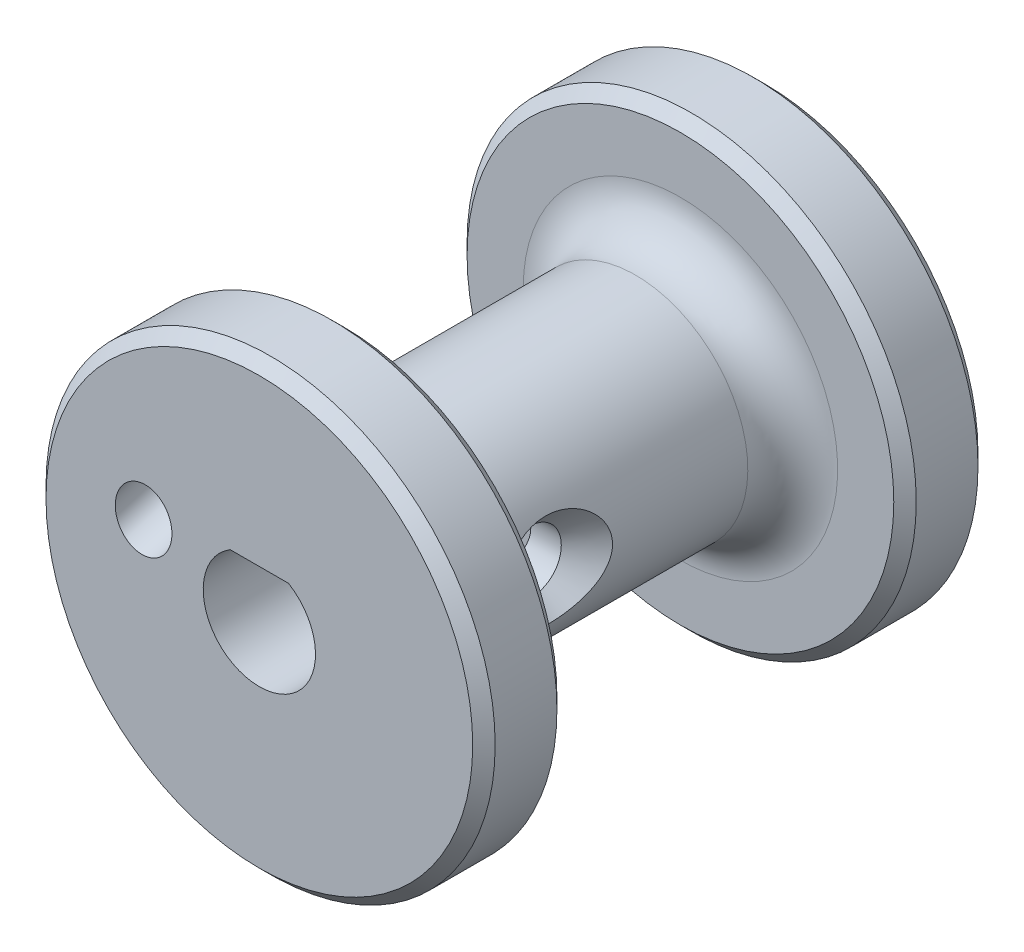
from build123d import *

# Parameters (mm, degrees)
BOSS_EXTRUDE1_DEPTH            = 9.525
BOSS_EXTRUDE1_DEPTH_BACK       = 9.525
SKETCH1_R                      = 6.35
SKETCH1_R_2                    = 3.175
SKETCH2_R                      = 12.7
SKETCH2_R_2                    = 6.35
SKETCH2_R_3                    = 3.175
BOSS_EXTRUDE3_DEPTH            = 4.7625
SKETCH3_R                      = 3.175
BOSS_EXTRUDE4_DEPTH            = 28.575
FILLET1_R                      = 2.54
CHAMFER1_SIZE                  = 0.635
CUT_EXTRUDE1_DEPTH             = 13.97
CUT_EXTRUDE2_REACH             = 39.354
SKETCH6_R                      = 1.5875
CUT_EXTRUDE2_DIRECTION_2_REACH = 39.354


# Read off the part's stored shape, not the designer's step: CSK for M3 Flat Head Machine Screw1
with BuildPart() as part:
    # Sketch1 → Boss-Extrude1 (new, two sides: drawn at the far end of the back side and taken through both)
    with BuildSketch(Plane.XY.offset(-BOSS_EXTRUDE1_DEPTH_BACK)):
        Circle(SKETCH1_R)
        Circle(SKETCH1_R_2, mode=Mode.SUBTRACT)
    extrude(amount=BOSS_EXTRUDE1_DEPTH + BOSS_EXTRUDE1_DEPTH_BACK)

    # Sketch2 → Boss-Extrude3 (add)
    # profile 1 of 2: a face of its own
    with BuildSketch(Plane(origin=(0, 0, -9.525), x_dir=(-1, 0, 0), z_dir=(0, 0, -1))):
        with Locations(Location((0, 0, 0), (0, 0, 180))):
            Circle(SKETCH2_R)
        with Locations(Location((0, 0, 0), (0, 0, 180))):
            Circle(SKETCH2_R_2, mode=Mode.SUBTRACT)
    # profile 2 of 2: a face of its own
    with BuildSketch(Plane(origin=(0, 0, -9.525), x_dir=(-1, 0, 0), z_dir=(0, 0, -1))):
        with Locations(Location((0, 0, 0), (0, 0, 180))):
            Circle(SKETCH2_R_2)
        with Locations(Location((0, 0, 0), (0, 0, 180))):
            Circle(SKETCH2_R_3, mode=Mode.SUBTRACT)
    boss_extrude3 = extrude(amount=BOSS_EXTRUDE3_DEPTH)

    # Mirror1: Boss-Extrude3 across plane
    add(boss_extrude3.mirror(Plane.XY))

    # Sketch3 → Boss-Extrude4 (add, through all)
    with BuildSketch(Plane(origin=(0, 0, -14.2875), x_dir=(-1, 0, 0), z_dir=(0, 0, -1))):
        Circle(SKETCH3_R)
    extrude(amount=-BOSS_EXTRUDE4_DEPTH)

    # Fillet1
    fillet1_edges = [part.edges().sort_by_distance(p)[0] for p in [
        (-6.35, 0, -9.525),
        (-6.35, 0, 9.525),
    ]]
    fillet(fillet1_edges, radius=FILLET1_R)

    # Chamfer1
    chamfer1_edges = [part.edges().sort_by_distance(p)[0] for p in [
        (-12.7, 0, -9.525),
        (-12.7, 0, -14.2875),
        (-12.7, 0, 14.2875),
        (-12.7, 0, 9.525),
    ]]
    chamfer(chamfer1_edges, length=CHAMFER1_SIZE)

    # Sketch4 → Cut-Extrude1 (cut)
    with BuildSketch(Plane.XY.offset(14.2875)):
        with BuildLine():
            Line((1.651, 2.711977876), (-1.651, 2.711977876))
            ThreePointArc((-1.651, 2.711977876), (-1.555425987, -2.767900829), (3.175, 0))
            ThreePointArc((3.175, 0), (2.767900829, 1.555425987), (1.651, 2.711977876))
        make_face()
    extrude(amount=-CUT_EXTRUDE1_DEPTH, mode=Mode.SUBTRACT)

    # Sketch6 → Cut-Extrude2 (cut, up to next)
    with BuildSketch(Plane(origin=(-6.544693312, 1.737013471, 14.2875), x_dir=(0.9927863104442903, -0.05092138559106857, 0.1085465535330304), z_dir=(-0.11989721345558171, -0.4216449495917331, 0.8987993072368112)), mode=Mode.PRIVATE) as cut_extrude2_sk1:
        with Locations(Location((0, 0, 0), (0, 0, 75.6633116))):
            Circle(SKETCH6_R)
    cut_extrude2_tool1 = extrude(cut_extrude2_sk1.sketch, amount=-CUT_EXTRUDE2_REACH, mode=Mode.PRIVATE) & part.part
    add(cut_extrude2_tool1.solids().sort_by_distance((-6.544693, 1.737013, 14.2875))[0], mode=Mode.SUBTRACT)

    # Sketch6 → Cut-Extrude2 direction 2 (cut, up to next)
    with BuildSketch(Plane(origin=(-6.544693312, 1.737013471, 14.2875), x_dir=(0.9927863104442903, -0.05092138559106857, 0.1085465535330304), z_dir=(-0.11989721345558171, -0.4216449495917331, 0.8987993072368112)), mode=Mode.PRIVATE) as cut_extrude2_direction_2_sk1:
        with Locations(Location((0, 0, 0), (0, 0, 75.6633116))):
            Circle(SKETCH6_R)
    cut_extrude2_direction_2_tool1 = extrude(cut_extrude2_direction_2_sk1.sketch, amount=CUT_EXTRUDE2_DIRECTION_2_REACH, mode=Mode.PRIVATE) & part.part
    add(cut_extrude2_direction_2_tool1.solids().sort_by_distance((-6.544693, 1.737013, 14.2875))[0], mode=Mode.SUBTRACT)

    # CSK for M3 Flat Head Machine Screw1 outl → CSK for M3 Flat Head Machine Screw1 (revolve, cut)
    with BuildSketch(Plane(origin=(0, 0, 3.811254633), x_dir=(-0.0350043317696159, 0.9993871605926117, 0), z_dir=(0, 0, -1))):
        Polygon((0, 2.681318057), (1.7, 2.681318057), (1.7, 4.9), (3.150097206, 6.350097206), (0, 6.350097206), align=None)
    revolve(axis=Axis((0, 0, 3.811254633), (0.9993871605926117, 0.0350043317696159, 0)), mode=Mode.SUBTRACT)


solid = part.part
